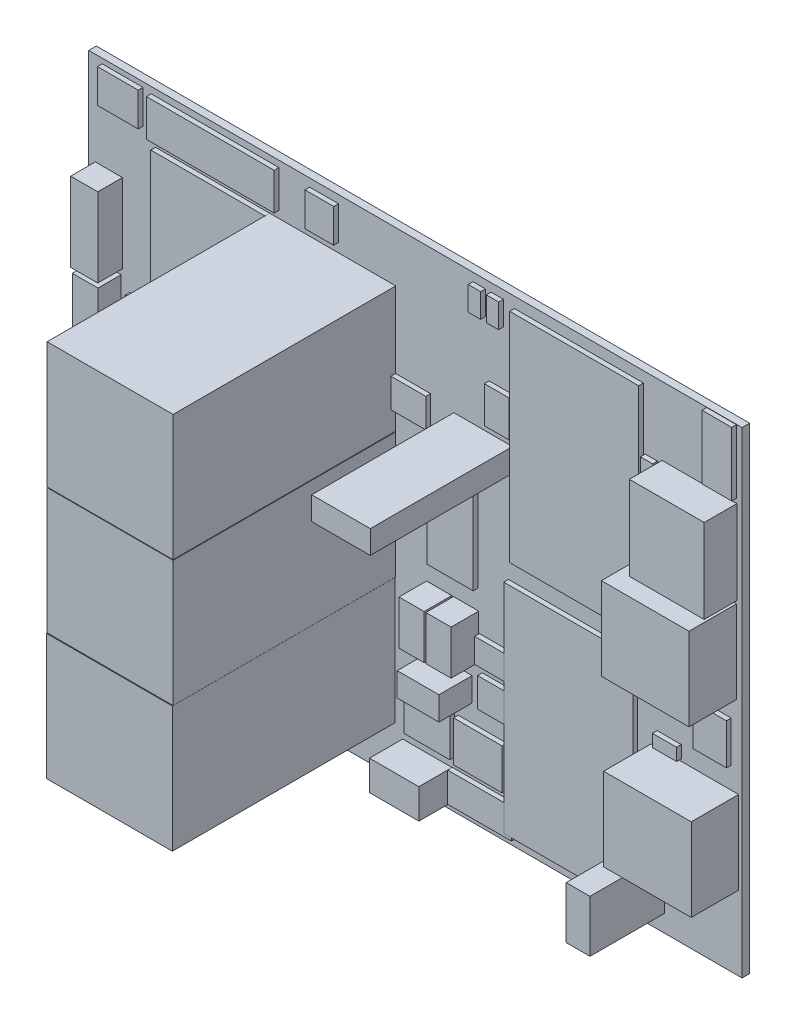
from build123d import *

# Parameters (mm, degrees)
ESQUISSE1_W                                    = 137.93375
ESQUISSE1_H                                    = 100.635
BOARD_DEPTH                                    = 1.6
ESQUISSE2_W                                    = 1.78
ESQUISSE2_H                                    = 3.14
CAP_0805_1_DEPTH                               = 1
ESQUISSE3_W                                    = 1.78
ESQUISSE3_H                                    = 3.14
CAP_0805_2_DEPTH                               = 1
ESQUISSE4_W                                    = 3.14
ESQUISSE4_H                                    = 1.78
CAP_0805_3_DEPTH                               = 1
ESQUISSE5_W                                    = 3.14
ESQUISSE5_H                                    = 1.78
CAP_0805_4_DEPTH                               = 1
ESQUISSE6_W                                    = 1.9914
ESQUISSE6_H                                    = 3.9968
EXTRUDE_C0805_1_DEPTH                          = 1
ESQUISSE7_W                                    = 1.9914
ESQUISSE7_H                                    = 3.9968
EXTRUDE_C0805_2_DEPTH                          = 1
ESQUISSE8_W                                    = 26.6
ESQUISSE8_H                                    = 26.55
SLPX102M200C4P3_47_000000_1_DEPTH              = 47
ESQUISSE9_W                                    = 26.6
ESQUISSE9_H                                    = 26.55
SLPX102M200C4P3_47_000000_2_DEPTH              = 47
ESQUISSE10_W                                   = 26.6
ESQUISSE10_H                                   = 26.55
SLPX102M200C4P3_47_000000_3_DEPTH              = 47
ESQUISSE11_W                                   = 5.425
ESQUISSE11_H                                   = 10.85
TO254P490X1000X2143_3P_4_900000_1_DEPTH        = 4.9
ESQUISSE12_W                                   = 5.425
ESQUISSE12_H                                   = 10.85
TO254P490X1000X2143_3P_4_900000_2_DEPTH        = 4.9
ESQUISSE13_W                                   = 6.35
ESQUISSE13_H                                   = 3.625
SOP50P490X110_10N_1_100000_1_DEPTH             = 1.1
ESQUISSE14_W                                   = 7.6835
ESQUISSE14_H                                   = 5.1435
AVRISP_1_DEPTH                                 = 1
ESQUISSE15_W                                   = 18.5
ESQUISSE15_H                                   = 17.49
UJ2BH1TH_10_000000_1_DEPTH                     = 10
ESQUISSE16_W                                   = 18.5
ESQUISSE16_H                                   = 17.49
UJ2BH1TH_10_000000_2_DEPTH                     = 10
ESQUISSE17_W                                   = 7.1
ESQUISSE17_H                                   = 8.62
EXTRUDE_691210910003_1_DEPTH                   = 1
ESQUISSE18_W                                   = 10.425
ESQUISSE18_H                                   = 6.3
SHDR3W64P0X250_1X3_990X575X700_7_000000_DEPTH  = 7
ESQUISSE19_W                                   = 13.46
ESQUISSE19_H                                   = 6.25
JST_B4B_XH_A_LF_SN_1_DEPTH                     = 1
ESQUISSE20_W                                   = 6.25
ESQUISSE20_H                                   = 13.46
JST_B4B_XH_A_LF_SN_2_DEPTH                     = 1
ESQUISSE21_W                                   = 6.08
ESQUISSE21_H                                   = 7.1
EXTRUDE_691210910002_1_DEPTH                   = 1
ESQUISSE22_W                                   = 8.62
ESQUISSE22_H                                   = 7.1
EXTRUDE_691210910003_2_DEPTH                   = 1
ESQUISSE23_W                                   = 25.5016
ESQUISSE23_H                                   = 5.2832
JTAG_20_1_DEPTH                                = 1
ESQUISSE24_W                                   = 6.08
ESQUISSE24_H                                   = 7.1
EXTRUDE_691210910002_2_DEPTH                   = 1
ESQUISSE25_W                                   = 8.62
ESQUISSE25_H                                   = 7.1
EXTRUDE_691210910003_3_DEPTH                   = 1
ESQUISSE26_W                                   = 15.8
ESQUISSE26_H                                   = 17.74
SS52100001_6_900000_1_DEPTH                    = 6.9
ESQUISSE27_W                                   = 5.08
ESQUISSE27_H                                   = 2.6162
EXTRUDE_1X02_1_DEPTH                           = 1
ESQUISSE28_W                                   = 5.08
ESQUISSE28_H                                   = 2.6162
EXTRUDE_1X02_2_DEPTH                           = 1
ESQUISSE29_W                                   = 2.6162
ESQUISSE29_H                                   = 5.08
EXTRUDE_1X02_3_DEPTH                           = 1
ESQUISSE30_W                                   = 5.1562
ESQUISSE30_H                                   = 7.6962
EXTRUDE_2X03_1_DEPTH                           = 1
ESQUISSE31_W                                   = 2.6162
ESQUISSE31_H                                   = 5.08
EXTRUDE_1X02_4_DEPTH                           = 1
ESQUISSE32_W                                   = 2.6162
ESQUISSE32_H                                   = 5.08
EXTRUDE_1X02_5_DEPTH                           = 1
ESQUISSE33_W                                   = 2.6162
ESQUISSE33_H                                   = 5.08
EXTRUDE_1X02_6_DEPTH                           = 1
ESQUISSE34_W                                   = 27.215
ESQUISSE34_H                                   = 45.954
IRM_10_1_DEPTH                                 = 1
ESQUISSE35_W                                   = 27.215
ESQUISSE35_H                                   = 45.954
IRM_10_2_DEPTH                                 = 1
ESQUISSE36_W                                   = 5.325
ESQUISSE36_H                                   = 9.35
DIP762W58P254L450H584Q4N_5_840000_1_DEPTH      = 5.84
ESQUISSE37_W                                   = 5.325
ESQUISSE37_H                                   = 9.35
DIP762W58P254L450H584Q4N_5_840000_2_DEPTH      = 5.84
ESQUISSE38_W                                   = 5.735
ESQUISSE38_H                                   = 16.68
TO545P521X1594X2566_3P_5_210000_1_DEPTH        = 5.21
ESQUISSE39_W                                   = 7.005
ESQUISSE39_H                                   = 4.28
ZTX458_4_010000_1_DEPTH                        = 4.01
ESQUISSE40_W                                   = 7.005
ESQUISSE40_H                                   = 4.28
ZTX458_4_010000_2_DEPTH                        = 4.01
ESQUISSE41_W                                   = 5.355
ESQUISSE41_H                                   = 11.21
TO254P483X1028X1700_3P_4_830000_1_DEPTH        = 4.83
ESQUISSE42_W                                   = 1.966
ESQUISSE42_H                                   = 3.946
EXTRUDE_R0805_1_DEPTH                          = 1
ESQUISSE43_W                                   = 1.966
ESQUISSE43_H                                   = 3.946
EXTRUDE_R0805_2_DEPTH                          = 1
ESQUISSE44_W                                   = 1.966
ESQUISSE44_H                                   = 3.946
EXTRUDE_R0805_3_DEPTH                          = 1
ESQUISSE45_W                                   = 3.946
ESQUISSE45_H                                   = 1.966
EXTRUDE_R0805_4_DEPTH                          = 1
ESQUISSE46_W                                   = 1.966
ESQUISSE46_H                                   = 3.946
EXTRUDE_R0805_5_DEPTH                          = 1
ESQUISSE47_W                                   = 1.966
ESQUISSE47_H                                   = 3.946
EXTRUDE_R0805_6_DEPTH                          = 1
ESQUISSE48_W                                   = 1.966
ESQUISSE48_H                                   = 3.946
EXTRUDE_R0805_7_DEPTH                          = 1
ESQUISSE49_W                                   = 1.966
ESQUISSE49_H                                   = 3.946
EXTRUDE_R0805_8_DEPTH                          = 1
ESQUISSE50_W                                   = 3.946
ESQUISSE50_H                                   = 1.966
EXTRUDE_R0805_9_DEPTH                          = 1
ESQUISSE51_W                                   = 1.966
ESQUISSE51_H                                   = 3.946
EXTRUDE_R0805_10_DEPTH                         = 1
ESQUISSE52_W                                   = 1.966
ESQUISSE52_H                                   = 3.946
EXTRUDE_R0805_11_DEPTH                         = 1
ESQUISSE53_W                                   = 1.966
ESQUISSE53_H                                   = 3.946
EXTRUDE_R0805_12_DEPTH                         = 1
ESQUISSE54_W                                   = 1.966
ESQUISSE54_H                                   = 3.946
EXTRUDE_R0805_13_DEPTH                         = 1
ESQUISSE55_W                                   = 3.946
ESQUISSE55_H                                   = 1.966
EXTRUDE_R0805_14_DEPTH                         = 1
ESQUISSE56_W                                   = 1.966
ESQUISSE56_H                                   = 3.946
EXTRUDE_R0805_15_DEPTH                         = 1
ESQUISSE57_W                                   = 3.946
ESQUISSE57_H                                   = 1.966
EXTRUDE_R0805_16_DEPTH                         = 1
ESQUISSE58_W                                   = 1.966
ESQUISSE58_H                                   = 3.946
EXTRUDE_R0805_17_DEPTH                         = 1
ESQUISSE59_W                                   = 3.946
ESQUISSE59_H                                   = 1.966
EXTRUDE_R0805_18_DEPTH                         = 1
ESQUISSE60_W                                   = 1.966
ESQUISSE60_H                                   = 3.946
EXTRUDE_R0805_19_DEPTH                         = 1
ESQUISSE61_W                                   = 3.946
ESQUISSE61_H                                   = 1.966
EXTRUDE_R0805_20_DEPTH                         = 1
ESQUISSE62_W                                   = 3.946
ESQUISSE62_H                                   = 1.966
EXTRUDE_R0805_21_DEPTH                         = 1
ESQUISSE63_W                                   = 3.946
ESQUISSE63_H                                   = 1.966
EXTRUDE_R0805_22_DEPTH                         = 1
ESQUISSE64_W                                   = 1.966
ESQUISSE64_H                                   = 3.946
EXTRUDE_R0805_23_DEPTH                         = 1
ESQUISSE65_W                                   = 3.946
ESQUISSE65_H                                   = 1.966
EXTRUDE_R0805_24_DEPTH                         = 1
ESQUISSE66_W                                   = 1.966
ESQUISSE66_H                                   = 3.946
EXTRUDE_R0805_25_DEPTH                         = 1
ESQUISSE67_W                                   = 1.966
ESQUISSE67_H                                   = 3.946
EXTRUDE_R0805_26_DEPTH                         = 1
ESQUISSE68_W                                   = 1.966
ESQUISSE68_H                                   = 3.946
EXTRUDE_R0805_27_DEPTH                         = 1
ESQUISSE69_W                                   = 1.966
ESQUISSE69_H                                   = 3.946
EXTRUDE_R0805_28_DEPTH                         = 1
ESQUISSE70_W                                   = 1.966
ESQUISSE70_H                                   = 3.946
EXTRUDE_R0805_29_DEPTH                         = 1
ESQUISSE71_W                                   = 1.966
ESQUISSE71_H                                   = 3.946
EXTRUDE_R0805_30_DEPTH                         = 1
ESQUISSE72_W                                   = 1.966
ESQUISSE72_H                                   = 3.946
EXTRUDE_R0805_31_DEPTH                         = 1
ESQUISSE73_W                                   = 1.966
ESQUISSE73_H                                   = 3.946
EXTRUDE_R0805_32_DEPTH                         = 1
ESQUISSE74_W                                   = 1.9914
ESQUISSE74_H                                   = 3.9968
EXTRUDE_M0805_1_DEPTH                          = 1
ESQUISSE75_W                                   = 1.9914
ESQUISSE75_H                                   = 3.9968
EXTRUDE_M0805_2_DEPTH                          = 1
ESQUISSE76_W                                   = 1.9914
ESQUISSE76_H                                   = 3.9968
EXTRUDE_M0805_3_DEPTH                          = 1
ESQUISSE77_W                                   = 1.9914
ESQUISSE77_H                                   = 3.9968
EXTRUDE_M0805_4_DEPTH                          = 1
ESQUISSE78_W                                   = 1.9914
ESQUISSE78_H                                   = 3.9968
EXTRUDE_M0805_5_DEPTH                          = 1
ESQUISSE79_W                                   = 1.9914
ESQUISSE79_H                                   = 3.9968
EXTRUDE_M0805_6_DEPTH                          = 1
ESQUISSE80_W                                   = 1.9914
ESQUISSE80_H                                   = 3.9968
EXTRUDE_M0805_7_DEPTH                          = 1
ESQUISSE81_W                                   = 1.9914
ESQUISSE81_H                                   = 3.9968
EXTRUDE_M0805_8_DEPTH                          = 1
ESQUISSE82_W                                   = 1.9914
ESQUISSE82_H                                   = 3.9968
EXTRUDE_M0805_9_DEPTH                          = 1
ESQUISSE83_W                                   = 1.9914
ESQUISSE83_H                                   = 3.9968
EXTRUDE_M0805_10_DEPTH                         = 1
ESQUISSE84_W                                   = 1.9914
ESQUISSE84_H                                   = 3.9968
EXTRUDE_M0805_11_DEPTH                         = 1
ESQUISSE85_W                                   = 1.9914
ESQUISSE85_H                                   = 3.9968
EXTRUDE_M0805_12_DEPTH                         = 1
ESQUISSE86_W                                   = 26.975
ESQUISSE86_H                                   = 7.8262
RS05_69_70_1_DEPTH                             = 1
ESQUISSE87_W                                   = 26.975
ESQUISSE87_H                                   = 7.8262
RS05_69_70_2_DEPTH                             = 1
ESQUISSE88_W                                   = 2.032
ESQUISSE88_H                                   = 7.874
EXTRUDE_0204_7_1_DEPTH                         = 1
ESQUISSE89_W                                   = 2.032
ESQUISSE89_H                                   = 7.874
EXTRUDE_0204_7_2_DEPTH                         = 1
ESQUISSE90_W                                   = 2.032
ESQUISSE90_H                                   = 7.874
EXTRUDE_0204_7_3_DEPTH                         = 1
ESQUISSE91_W                                   = 7.874
ESQUISSE91_H                                   = 2.032
EXTRUDE_0204_7_4_DEPTH                         = 1
ESQUISSE92_W                                   = 2.032
ESQUISSE92_H                                   = 7.874
EXTRUDE_0204_7_5_DEPTH                         = 1
ESQUISSE93_W                                   = 7.874
ESQUISSE93_H                                   = 2.032
EXTRUDE_0204_7_6_DEPTH                         = 1
ESQUISSE94_W                                   = 7.622509
ESQUISSE94_H                                   = 6.139509
EXTRUDE_1825910_6_1_DEPTH                      = 1
ESQUISSE95_W                                   = 7.622509
ESQUISSE95_H                                   = 6.139509
EXTRUDE_1825910_6_2_DEPTH                      = 1
ESQUISSE96_W                                   = 7.8592
ESQUISSE96_H                                   = 10.6354
SSOP28DB_1_DEPTH                               = 1
ESQUISSE97_W                                   = 5.02
ESQUISSE97_H                                   = 10.975
ON_SEMI_LM317BTG_0_15_750000_1_DEPTH           = 15.75
ESQUISSE98_W                                   = 9.6
ESQUISSE98_H                                   = 7.7
NATIONAL_SEMICONDUCTOR_LM1117IMPX_3_3_NO_DEPTH = 1
ESQUISSE99_W                                   = 9.6
ESQUISSE99_H                                   = 7.7
NATIONAL_SEMICONDUCTOR_LM1117IMPX_3_2_DEPTH    = 1
ESQUISSE100_W                                  = 11
ESQUISSE100_H                                  = 11
QFP80P900X900X120_32N_1_DEPTH                  = 1
ESQUISSE101_W                                  = 9.7
ESQUISSE101_H                                  = 10.71
TEXAS_INSTRUMENTS_TLC2262CP_0_1_DEPTH          = 1
ESQUISSE102_W                                  = 10.2362
ESQUISSE102_H                                  = 8.5852
DIP254P762X533_8_1_DEPTH                       = 1
ESQUISSE103_W                                  = 9.7
ESQUISSE103_H                                  = 20.2
TEXAS_INSTRUMENTS_TLC2264CN_0_1_DEPTH          = 1
ESQUISSE104_W                                  = 24.1
ESQUISSE104_H                                  = 34.2
SC_10_30J_1_DEPTH                              = 1
ESQUISSE105_W                                  = 24.1
ESQUISSE105_H                                  = 34.2
SC_10_30J_2_DEPTH                              = 1
ESQUISSE106_W                                  = 10.42
ESQUISSE106_H                                  = 11.46
QFP50P900X900X160_48N_1_DEPTH                  = 1
ESQUISSE107_W                                  = 12.376
ESQUISSE107_H                                  = 4.902
FOX_ELECTRONICS_FOXSLF_080_20_0_30_02000_DEPTH = 30.02
ESQUISSE108_W                                  = 8.826
ESQUISSE108_H                                  = 5
CSTLS16M0X53ZA0_7_000000_1_DEPTH               = 7


with BuildPart() as part:
    # Esquisse1 → BOARD (new body)
    with BuildSketch(Plane.XY):
        with Locations((66.903125, 50.15875)):
            Rectangle(ESQUISSE1_W, ESQUISSE1_H)
    extrude(amount=BOARD_DEPTH)


with BuildPart() as body_2:
    # Esquisse2 → CAP_0805-1 (new body)
    with BuildSketch(Plane.XY):
        with Locations((110.01375, 27.78125)):
            Rectangle(ESQUISSE2_W, ESQUISSE2_H)
    extrude(amount=-CAP_0805_1_DEPTH)


with BuildPart() as body_3:
    # Esquisse3 → CAP_0805-2 (new body)
    with BuildSketch(Plane.XY):
        with Locations((110.01375, 24.4475)):
            Rectangle(ESQUISSE3_W, ESQUISSE3_H)
    extrude(amount=-CAP_0805_2_DEPTH)


with BuildPart() as body_4:
    # Esquisse4 → CAP_0805-3 (new body)
    with BuildSketch(Plane.XY):
        with Locations((95.72625, 24.92375)):
            Rectangle(ESQUISSE4_W, ESQUISSE4_H)
    extrude(amount=-CAP_0805_3_DEPTH)


with BuildPart() as body_5:
    # Esquisse5 → CAP_0805-4 (new body)
    with BuildSketch(Plane.XY):
        with Locations((96.36125, 38.735)):
            Rectangle(ESQUISSE5_W, ESQUISSE5_H)
    extrude(amount=-CAP_0805_4_DEPTH)


with BuildPart() as body_6:
    # Esquisse6 → C0805-1 (new body)
    with BuildSketch(Plane.XY):
        with Locations((69.04355, 17.78)):
            Rectangle(ESQUISSE6_W, ESQUISSE6_H)
    extrude(amount=-EXTRUDE_C0805_1_DEPTH)


with BuildPart() as body_7:
    # Esquisse7 → C0805-2 (new body)
    with BuildSketch(Plane.XY):
        with Locations((69.04355, 12.3825)):
            Rectangle(ESQUISSE7_W, ESQUISSE7_H)
    extrude(amount=-EXTRUDE_C0805_2_DEPTH)


with BuildPart() as body_8:
    # Esquisse8 → SLPX102M200C4P3_47.000000-1 (new body)
    with BuildSketch(Plane.XY.offset(1.6)):
        with Locations((49.45, 49.8725)):
            Rectangle(ESQUISSE8_W, ESQUISSE8_H)
    extrude(amount=SLPX102M200C4P3_47_000000_1_DEPTH)


with BuildPart() as body_9:
    # Esquisse9 → SLPX102M200C4P3_47.000000-2 (new body)
    with BuildSketch(Plane.XY.offset(1.6)):
        with Locations((49.45, 76.5425)):
            Rectangle(ESQUISSE9_W, ESQUISSE9_H)
    extrude(amount=SLPX102M200C4P3_47_000000_2_DEPTH)


with BuildPart() as body_10:
    # Esquisse10 → SLPX102M200C4P3_47.000000-3 (new body)
    with BuildSketch(Plane.XY.offset(1.6)):
        with Locations((49.2925, 23.1525)):
            Rectangle(ESQUISSE10_W, ESQUISSE10_H)
    extrude(amount=SLPX102M200C4P3_47_000000_3_DEPTH)


with BuildPart() as body_11:
    # Esquisse11 → TO254P490X1000X2143-3P_4.900000-1 (new body)
    with BuildSketch(Plane.XY.offset(1.6)):
        with Locations((2.075, 57.4675)):
            Rectangle(ESQUISSE11_W, ESQUISSE11_H)
    extrude(amount=TO254P490X1000X2143_3P_4_900000_1_DEPTH)


with BuildPart() as body_12:
    # Esquisse12 → TO254P490X1000X2143-3P_4.900000-2 (new body)
    with BuildSketch(Plane.XY.offset(1.6)):
        with Locations((1.7575, 28.575)):
            Rectangle(ESQUISSE12_W, ESQUISSE12_H)
    extrude(amount=TO254P490X1000X2143_3P_4_900000_2_DEPTH)


with BuildPart() as body_13:
    # Esquisse13 → SOP50P490X110-10N_1.100000-1 (new body)
    with BuildSketch(Plane.XY):
        with Locations((82.70875, 13.64)):
            Rectangle(ESQUISSE13_W, ESQUISSE13_H)
    extrude(amount=-SOP50P490X110_10N_1_100000_1_DEPTH)


with BuildPart() as body_14:
    # Esquisse14 → AVRISP-1 (new body)
    with BuildSketch(Plane.XY.offset(1.6)):
        with Locations((84.2645, 32.512)):
            Rectangle(ESQUISSE14_W, ESQUISSE14_H)
    extrude(amount=AVRISP_1_DEPTH)


with BuildPart() as body_15:
    # Esquisse15 → UJ2BH1TH_10.000000-1 (new body)
    with BuildSketch(Plane.XY.offset(1.6)):
        with Locations((125.89375, 24.28875)):
            Rectangle(ESQUISSE15_W, ESQUISSE15_H)
    extrude(amount=UJ2BH1TH_10_000000_1_DEPTH)


with BuildPart() as body_16:
    # Esquisse16 → UJ2BH1TH_10.000000-2 (new body)
    with BuildSketch(Plane.XY.offset(1.6)):
        with Locations((125.4175, 58.89625)):
            Rectangle(ESQUISSE16_W, ESQUISSE16_H)
    extrude(amount=UJ2BH1TH_10_000000_2_DEPTH)


with BuildPart() as body_17:
    # Esquisse17 → 691210910003-1 (new body)
    with BuildSketch(Plane.XY.offset(1.6)):
        with Locations((130.01625, 41.91)):
            Rectangle(ESQUISSE17_W, ESQUISSE17_H)
    extrude(amount=EXTRUDE_691210910003_1_DEPTH)


with BuildPart() as body_18:
    # Esquisse18 → SHDR3W64P0X250_1X3_990X575X700_7.000000-1 (new body)
    with BuildSketch(Plane.XY.offset(1.6)):
        with Locations((69.42625, 4.555)):
            Rectangle(ESQUISSE18_W, ESQUISSE18_H)
    extrude(amount=SHDR3W64P0X250_1X3_990X575X700_7_000000_DEPTH)


with BuildPart() as body_19:
    # Esquisse19 → JST_B4B-XH-A_LF__SN_-1 (new body)
    with BuildSketch(Plane.XY.offset(1.6)):
        with Locations((81.46125, 4.6525)):
            Rectangle(ESQUISSE19_W, ESQUISSE19_H)
    extrude(amount=JST_B4B_XH_A_LF_SN_1_DEPTH)


with BuildPart() as body_20:
    # Esquisse20 → JST_B4B-XH-A_LF__SN_-2 (new body)
    with BuildSketch(Plane.XY.offset(1.6)):
        with Locations((131.555, 93.685)):
            Rectangle(ESQUISSE20_W, ESQUISSE20_H)
    extrude(amount=JST_B4B_XH_A_LF_SN_2_DEPTH)


with BuildPart() as body_21:
    # Esquisse21 → 691210910002-1 (new body)
    with BuildSketch(Plane.XY.offset(1.6)):
        with Locations((47.625, 95.25)):
            Rectangle(ESQUISSE21_W, ESQUISSE21_H)
    extrude(amount=EXTRUDE_691210910002_1_DEPTH)


with BuildPart() as body_22:
    # Esquisse22 → 691210910003-2 (new body)
    with BuildSketch(Plane.XY.offset(1.6)):
        with Locations((5.08, 95.885)):
            Rectangle(ESQUISSE22_W, ESQUISSE22_H)
    extrude(amount=EXTRUDE_691210910003_2_DEPTH)


with BuildPart() as body_23:
    # Esquisse23 → JTAG-20-1 (new body)
    with BuildSketch(Plane.XY):
        with Locations((65.3542, 96.2025)):
            Rectangle(ESQUISSE23_W, ESQUISSE23_H)
    extrude(amount=-JTAG_20_1_DEPTH)


with BuildPart() as body_24:
    # Esquisse24 → 691210910002-2 (new body)
    with BuildSketch(Plane.XY.offset(1.6)):
        with Locations((46.99, 4.7625)):
            Rectangle(ESQUISSE24_W, ESQUISSE24_H)
    extrude(amount=EXTRUDE_691210910002_2_DEPTH)


with BuildPart() as body_25:
    # Esquisse25 → 691210910003-3 (new body)
    with BuildSketch(Plane.XY.offset(1.6)):
        with Locations((5.715, 4.445)):
            Rectangle(ESQUISSE25_W, ESQUISSE25_H)
    extrude(amount=EXTRUDE_691210910003_3_DEPTH)


with BuildPart() as body_26:
    # Esquisse26 → SS52100001_6.900000-1 (new body)
    with BuildSketch(Plane.XY.offset(1.6)):
        with Locations((126.875, 77.16)):
            Rectangle(ESQUISSE26_W, ESQUISSE26_H)
    extrude(amount=SS52100001_6_900000_1_DEPTH)


with BuildPart() as body_27:
    # Esquisse27 → 1X02-1 (new body)
    with BuildSketch(Plane.XY.offset(1.6)):
        with Locations((120.49125, 34.80435)):
            Rectangle(ESQUISSE27_W, ESQUISSE27_H)
    extrude(amount=EXTRUDE_1X02_1_DEPTH)


with BuildPart() as body_28:
    # Esquisse28 → 1X02-2 (new body)
    with BuildSketch(Plane.XY.offset(1.6)):
        with Locations((121.44375, 48.13935)):
            Rectangle(ESQUISSE28_W, ESQUISSE28_H)
    extrude(amount=EXTRUDE_1X02_2_DEPTH)


with BuildPart() as body_29:
    # Esquisse29 → 1X02-3 (new body)
    with BuildSketch(Plane.XY.offset(1.6)):
        with Locations((116.8781, 71.27875)):
            Rectangle(ESQUISSE29_W, ESQUISSE29_H)
    extrude(amount=EXTRUDE_1X02_3_DEPTH)


with BuildPart() as body_30:
    # Esquisse30 → 2X03-1 (new body)
    with BuildSketch(Plane.XY.offset(1.6)):
        with Locations((85.0519, 78.4606)):
            Rectangle(ESQUISSE30_W, ESQUISSE30_H)
    extrude(amount=EXTRUDE_2X03_1_DEPTH)


with BuildPart() as body_31:
    # Esquisse31 → 1X02-4 (new body)
    with BuildSketch(Plane.XY.offset(1.6)):
        with Locations((84.1756, 96.2025)):
            Rectangle(ESQUISSE31_W, ESQUISSE31_H)
    extrude(amount=EXTRUDE_1X02_4_DEPTH)


with BuildPart() as body_32:
    # Esquisse32 → 1X02-5 (new body)
    with BuildSketch(Plane.XY.offset(1.6)):
        with Locations((80.3656, 96.2025)):
            Rectangle(ESQUISSE32_W, ESQUISSE32_H)
    extrude(amount=EXTRUDE_1X02_5_DEPTH)


with BuildPart() as body_33:
    # Esquisse33 → 1X02-6 (new body)
    with BuildSketch(Plane.XY.offset(1.6)):
        with Locations((116.71935, 82.8675)):
            Rectangle(ESQUISSE33_W, ESQUISSE33_H)
    extrude(amount=EXTRUDE_1X02_6_DEPTH)


with BuildPart() as body_34:
    # Esquisse34 → IRM-10-1 (new body)
    with BuildSketch(Plane.XY.offset(1.6)):
        with Locations((100.1845, 25.0925)):
            Rectangle(ESQUISSE34_W, ESQUISSE34_H)
    extrude(amount=IRM_10_1_DEPTH)


with BuildPart() as body_35:
    # Esquisse35 → IRM-10-2 (new body)
    with BuildSketch(Plane.XY.offset(1.6)):
        with Locations((101.428, 75.2375)):
            Rectangle(ESQUISSE35_W, ESQUISSE35_H)
    extrude(amount=IRM_10_2_DEPTH)


with BuildPart() as body_36:
    # Esquisse36 → DIP762W58P254L450H584Q4N_5.840000-1 (new body)
    with BuildSketch(Plane.XY.offset(1.6)):
        with Locations((77.61625, 34.44875)):
            Rectangle(ESQUISSE36_W, ESQUISSE36_H)
    extrude(amount=DIP762W58P254L450H584Q4N_5_840000_1_DEPTH)


with BuildPart() as body_37:
    # Esquisse37 → DIP762W58P254L450H584Q4N_5.840000-2 (new body)
    with BuildSketch(Plane.XY.offset(1.6)):
        with Locations((71.92625, 34.44875)):
            Rectangle(ESQUISSE37_W, ESQUISSE37_H)
    extrude(amount=DIP762W58P254L450H584Q4N_5_840000_2_DEPTH)


with BuildPart() as body_38:
    # Esquisse38 → TO545P521X1594X2566-3P_5.210000-1 (new body)
    with BuildSketch(Plane.XY.offset(1.6)):
        with Locations((2.1925, 72.4425)):
            Rectangle(ESQUISSE38_W, ESQUISSE38_H)
    extrude(amount=TO545P521X1594X2566_3P_5_210000_1_DEPTH)


with BuildPart() as body_39:
    # Esquisse39 → ZTX458_4.010000-1 (new body)
    with BuildSketch(Plane.XY.offset(1.6)):
        with Locations((17.88, 53.0225)):
            Rectangle(ESQUISSE39_W, ESQUISSE39_H)
    extrude(amount=ZTX458_4_010000_1_DEPTH)


with BuildPart() as body_40:
    # Esquisse40 → ZTX458_4.010000-2 (new body)
    with BuildSketch(Plane.XY.offset(1.6)):
        with Locations((17.88, 46.99)):
            Rectangle(ESQUISSE40_W, ESQUISSE40_H)
    extrude(amount=ZTX458_4_010000_2_DEPTH)


with BuildPart() as body_41:
    # Esquisse41 → TO254P483X1028X1700-3P_4.830000-1 (new body)
    with BuildSketch(Plane.XY.offset(1.6)):
        with Locations((1.8725, 15.875)):
            Rectangle(ESQUISSE41_W, ESQUISSE41_H)
    extrude(amount=TO254P483X1028X1700_3P_4_830000_1_DEPTH)


with BuildPart() as body_42:
    # Esquisse42 → R0805-1 (new body)
    with BuildSketch(Plane.XY):
        with Locations((110.01375, 16.51)):
            Rectangle(ESQUISSE42_W, ESQUISSE42_H)
    extrude(amount=-EXTRUDE_R0805_1_DEPTH)


with BuildPart() as body_43:
    # Esquisse43 → R0805-2 (new body)
    with BuildSketch(Plane.XY):
        with Locations((110.01375, 12.22375)):
            Rectangle(ESQUISSE43_W, ESQUISSE43_H)
    extrude(amount=-EXTRUDE_R0805_2_DEPTH)


with BuildPart() as body_44:
    # Esquisse44 → R0805-3 (new body)
    with BuildSketch(Plane.XY):
        with Locations((119.53875, 10.31875)):
            Rectangle(ESQUISSE44_W, ESQUISSE44_H)
    extrude(amount=-EXTRUDE_R0805_3_DEPTH)


with BuildPart() as body_45:
    # Esquisse45 → R0805-4 (new body)
    with BuildSketch(Plane.XY):
        with Locations((70.64375, 7.3025)):
            Rectangle(ESQUISSE45_W, ESQUISSE45_H)
    extrude(amount=-EXTRUDE_R0805_4_DEPTH)


with BuildPart() as body_46:
    # Esquisse46 → R0805-5 (new body)
    with BuildSketch(Plane.XY):
        with Locations((121.76125, 10.31875)):
            Rectangle(ESQUISSE46_W, ESQUISSE46_H)
    extrude(amount=-EXTRUDE_R0805_5_DEPTH)


with BuildPart() as body_47:
    # Esquisse47 → R0805-6 (new body)
    with BuildSketch(Plane.XY):
        with Locations((121.76125, 6.19125)):
            Rectangle(ESQUISSE47_W, ESQUISSE47_H)
    extrude(amount=-EXTRUDE_R0805_6_DEPTH)


with BuildPart() as body_48:
    # Esquisse48 → R0805-7 (new body)
    with BuildSketch(Plane.XY):
        with Locations((107.47375, 25.87625)):
            Rectangle(ESQUISSE48_W, ESQUISSE48_H)
    extrude(amount=-EXTRUDE_R0805_7_DEPTH)


with BuildPart() as body_49:
    # Esquisse49 → R0805-8 (new body)
    with BuildSketch(Plane.XY):
        with Locations((105.25125, 25.87625)):
            Rectangle(ESQUISSE49_W, ESQUISSE49_H)
    extrude(amount=-EXTRUDE_R0805_8_DEPTH)


with BuildPart() as body_50:
    # Esquisse50 → R0805-9 (new body)
    with BuildSketch(Plane.XY):
        with Locations((84.455, 22.86)):
            Rectangle(ESQUISSE50_W, ESQUISSE50_H)
    extrude(amount=-EXTRUDE_R0805_9_DEPTH)


with BuildPart() as body_51:
    # Esquisse51 → R0805-10 (new body)
    with BuildSketch(Plane.XY):
        with Locations((77.31125, 13.6525)):
            Rectangle(ESQUISSE51_W, ESQUISSE51_H)
    extrude(amount=-EXTRUDE_R0805_10_DEPTH)


with BuildPart() as body_52:
    # Esquisse52 → R0805-11 (new body)
    with BuildSketch(Plane.XY):
        with Locations((71.755, 17.78)):
            Rectangle(ESQUISSE52_W, ESQUISSE52_H)
    extrude(amount=-EXTRUDE_R0805_11_DEPTH)


with BuildPart() as body_53:
    # Esquisse53 → R0805-12 (new body)
    with BuildSketch(Plane.XY):
        with Locations((71.59625, 12.3825)):
            Rectangle(ESQUISSE53_W, ESQUISSE53_H)
    extrude(amount=-EXTRUDE_R0805_12_DEPTH)


with BuildPart() as body_54:
    # Esquisse54 → R0805-13 (new body)
    with BuildSketch(Plane.XY):
        with Locations((73.3425, 46.99)):
            Rectangle(ESQUISSE54_W, ESQUISSE54_H)
    extrude(amount=-EXTRUDE_R0805_13_DEPTH)


with BuildPart() as body_55:
    # Esquisse55 → R0805-14 (new body)
    with BuildSketch(Plane.XY):
        with Locations((77.31125, 28.41625)):
            Rectangle(ESQUISSE55_W, ESQUISSE55_H)
    extrude(amount=-EXTRUDE_R0805_14_DEPTH)


with BuildPart() as body_56:
    # Esquisse56 → R0805-15 (new body)
    with BuildSketch(Plane.XY):
        with Locations((69.215, 46.99)):
            Rectangle(ESQUISSE56_W, ESQUISSE56_H)
    extrude(amount=-EXTRUDE_R0805_15_DEPTH)


with BuildPart() as body_57:
    # Esquisse57 → R0805-16 (new body)
    with BuildSketch(Plane.XY):
        with Locations((119.22125, 55.245)):
            Rectangle(ESQUISSE57_W, ESQUISSE57_H)
    extrude(amount=-EXTRUDE_R0805_16_DEPTH)


with BuildPart() as body_58:
    # Esquisse58 → R0805-17 (new body)
    with BuildSketch(Plane.XY):
        with Locations((73.3425, 51.7525)):
            Rectangle(ESQUISSE58_W, ESQUISSE58_H)
    extrude(amount=-EXTRUDE_R0805_17_DEPTH)


with BuildPart() as body_59:
    # Esquisse59 → R0805-18 (new body)
    with BuildSketch(Plane.XY):
        with Locations((77.94625, 40.3225)):
            Rectangle(ESQUISSE59_W, ESQUISSE59_H)
    extrude(amount=-EXTRUDE_R0805_18_DEPTH)


with BuildPart() as body_60:
    # Esquisse60 → R0805-19 (new body)
    with BuildSketch(Plane.XY):
        with Locations((69.215, 51.7525)):
            Rectangle(ESQUISSE60_W, ESQUISSE60_H)
    extrude(amount=-EXTRUDE_R0805_19_DEPTH)


with BuildPart() as body_61:
    # Esquisse61 → R0805-20 (new body)
    with BuildSketch(Plane.XY):
        with Locations((119.22125, 59.69)):
            Rectangle(ESQUISSE61_W, ESQUISSE61_H)
    extrude(amount=-EXTRUDE_R0805_20_DEPTH)


with BuildPart() as body_62:
    # Esquisse62 → R0805-21 (new body)
    with BuildSketch(Plane.XY):
        with Locations((72.23125, 40.48125)):
            Rectangle(ESQUISSE62_W, ESQUISSE62_H)
    extrude(amount=-EXTRUDE_R0805_21_DEPTH)


with BuildPart() as body_63:
    # Esquisse63 → R0805-22 (new body)
    with BuildSketch(Plane.XY):
        with Locations((119.22125, 57.4675)):
            Rectangle(ESQUISSE63_W, ESQUISSE63_H)
    extrude(amount=-EXTRUDE_R0805_22_DEPTH)


with BuildPart() as body_64:
    # Esquisse64 → R0805-23 (new body)
    with BuildSketch(Plane.XY):
        with Locations((73.3425, 59.3725)):
            Rectangle(ESQUISSE64_W, ESQUISSE64_H)
    extrude(amount=-EXTRUDE_R0805_23_DEPTH)


with BuildPart() as body_65:
    # Esquisse65 → R0805-24 (new body)
    with BuildSketch(Plane.XY):
        with Locations((71.59625, 28.41625)):
            Rectangle(ESQUISSE65_W, ESQUISSE65_H)
    extrude(amount=-EXTRUDE_R0805_24_DEPTH)


with BuildPart() as body_66:
    # Esquisse66 → R0805-25 (new body)
    with BuildSketch(Plane.XY):
        with Locations((69.215, 59.3725)):
            Rectangle(ESQUISSE66_W, ESQUISSE66_H)
    extrude(amount=-EXTRUDE_R0805_25_DEPTH)


with BuildPart() as body_67:
    # Esquisse67 → R0805-26 (new body)
    with BuildSketch(Plane.XY):
        with Locations((77.1525, 59.3725)):
            Rectangle(ESQUISSE67_W, ESQUISSE67_H)
    extrude(amount=-EXTRUDE_R0805_26_DEPTH)


with BuildPart() as body_68:
    # Esquisse68 → R0805-27 (new body)
    with BuildSketch(Plane.XY):
        with Locations((81.28, 59.3725)):
            Rectangle(ESQUISSE68_W, ESQUISSE68_H)
    extrude(amount=-EXTRUDE_R0805_27_DEPTH)


with BuildPart() as body_69:
    # Esquisse69 → R0805-28 (new body)
    with BuildSketch(Plane.XY):
        with Locations((69.85, 65.56375)):
            Rectangle(ESQUISSE69_W, ESQUISSE69_H)
    extrude(amount=-EXTRUDE_R0805_28_DEPTH)


with BuildPart() as body_70:
    # Esquisse70 → R0805-29 (new body)
    with BuildSketch(Plane.XY):
        with Locations((77.1525, 46.99)):
            Rectangle(ESQUISSE70_W, ESQUISSE70_H)
    extrude(amount=-EXTRUDE_R0805_29_DEPTH)


with BuildPart() as body_71:
    # Esquisse71 → R0805-30 (new body)
    with BuildSketch(Plane.XY):
        with Locations((81.28, 46.99)):
            Rectangle(ESQUISSE71_W, ESQUISSE71_H)
    extrude(amount=-EXTRUDE_R0805_30_DEPTH)


with BuildPart() as body_72:
    # Esquisse72 → R0805-31 (new body)
    with BuildSketch(Plane.XY):
        with Locations((81.28, 51.7525)):
            Rectangle(ESQUISSE72_W, ESQUISSE72_H)
    extrude(amount=-EXTRUDE_R0805_31_DEPTH)


with BuildPart() as body_73:
    # Esquisse73 → R0805-32 (new body)
    with BuildSketch(Plane.XY):
        with Locations((77.1525, 51.7525)):
            Rectangle(ESQUISSE73_W, ESQUISSE73_H)
    extrude(amount=-EXTRUDE_R0805_32_DEPTH)


with BuildPart() as body_74:
    # Esquisse74 → M0805-1 (new body)
    with BuildSketch(Plane.XY):
        with Locations((67.6402, 89.2175)):
            Rectangle(ESQUISSE74_W, ESQUISSE74_H)
    extrude(amount=-EXTRUDE_M0805_1_DEPTH)


with BuildPart() as body_75:
    # Esquisse75 → M0805-2 (new body)
    with BuildSketch(Plane.XY):
        with Locations((69.8627, 89.2175)):
            Rectangle(ESQUISSE75_W, ESQUISSE75_H)
    extrude(amount=-EXTRUDE_M0805_2_DEPTH)


with BuildPart() as body_76:
    # Esquisse76 → M0805-3 (new body)
    with BuildSketch(Plane.XY):
        with Locations((72.0852, 89.2175)):
            Rectangle(ESQUISSE76_W, ESQUISSE76_H)
    extrude(amount=-EXTRUDE_M0805_3_DEPTH)


with BuildPart() as body_77:
    # Esquisse77 → M0805-4 (new body)
    with BuildSketch(Plane.XY):
        with Locations((81.5848, 89.2175)):
            Rectangle(ESQUISSE77_W, ESQUISSE77_H)
    extrude(amount=-EXTRUDE_M0805_4_DEPTH)


with BuildPart() as body_78:
    # Esquisse78 → M0805-5 (new body)
    with BuildSketch(Plane.XY):
        with Locations((83.8073, 89.2175)):
            Rectangle(ESQUISSE78_W, ESQUISSE78_H)
    extrude(amount=-EXTRUDE_M0805_5_DEPTH)


with BuildPart() as body_79:
    # Esquisse79 → M0805-6 (new body)
    with BuildSketch(Plane.XY):
        with Locations((79.3623, 89.2175)):
            Rectangle(ESQUISSE79_W, ESQUISSE79_H)
    extrude(amount=-EXTRUDE_M0805_6_DEPTH)


with BuildPart() as body_80:
    # Esquisse80 → M0805-7 (new body)
    with BuildSketch(Plane.XY):
        with Locations((74.44105, 89.2175)):
            Rectangle(ESQUISSE80_W, ESQUISSE80_H)
    extrude(amount=-EXTRUDE_M0805_7_DEPTH)


with BuildPart() as body_81:
    # Esquisse81 → M0805-8 (new body)
    with BuildSketch(Plane.XY):
        with Locations((76.8477, 89.2175)):
            Rectangle(ESQUISSE81_W, ESQUISSE81_H)
    extrude(amount=-EXTRUDE_M0805_8_DEPTH)


with BuildPart() as body_82:
    # Esquisse82 → M0805-9 (new body)
    with BuildSketch(Plane.XY):
        with Locations((76.1873, 65.56375)):
            Rectangle(ESQUISSE82_W, ESQUISSE82_H)
    extrude(amount=-EXTRUDE_M0805_9_DEPTH)


with BuildPart() as body_83:
    # Esquisse83 → M0805-10 (new body)
    with BuildSketch(Plane.XY):
        with Locations((78.25105, 65.56375)):
            Rectangle(ESQUISSE83_W, ESQUISSE83_H)
    extrude(amount=-EXTRUDE_M0805_10_DEPTH)


with BuildPart() as body_84:
    # Esquisse84 → M0805-11 (new body)
    with BuildSketch(Plane.XY):
        with Locations((72.0598, 65.56375)):
            Rectangle(ESQUISSE84_W, ESQUISSE84_H)
    extrude(amount=-EXTRUDE_M0805_11_DEPTH)


with BuildPart() as body_85:
    # Esquisse85 → M0805-12 (new body)
    with BuildSketch(Plane.XY):
        with Locations((74.12355, 65.56375)):
            Rectangle(ESQUISSE85_W, ESQUISSE85_H)
    extrude(amount=-EXTRUDE_M0805_12_DEPTH)


with BuildPart() as body_86:
    # Esquisse86 → RS05_69-70-1 (new body)
    with BuildSketch(Plane.XY.offset(1.6)):
        with Locations((24.6, 95.2119)):
            Rectangle(ESQUISSE86_W, ESQUISSE86_H)
    extrude(amount=RS05_69_70_1_DEPTH)


with BuildPart() as body_87:
    # Esquisse87 → RS05_69-70-2 (new body)
    with BuildSketch(Plane.XY.offset(1.6)):
        with Locations((25.235, 4.7244)):
            Rectangle(ESQUISSE87_W, ESQUISSE87_H)
    extrude(amount=RS05_69_70_2_DEPTH)


with BuildPart() as body_88:
    # Esquisse88 → 0204_7-1 (new body)
    with BuildSketch(Plane.XY):
        with Locations((7.62, 72.1995)):
            Rectangle(ESQUISSE88_W, ESQUISSE88_H)
    extrude(amount=-EXTRUDE_0204_7_1_DEPTH)


with BuildPart() as body_89:
    # Esquisse89 → 0204_7-2 (new body)
    with BuildSketch(Plane.XY.offset(1.6)):
        with Locations((7.62, 56.642)):
            Rectangle(ESQUISSE89_W, ESQUISSE89_H)
    extrude(amount=EXTRUDE_0204_7_2_DEPTH)


with BuildPart() as body_90:
    # Esquisse90 → 0204_7-3 (new body)
    with BuildSketch(Plane.XY.offset(1.6)):
        with Locations((7.62, 15.4305)):
            Rectangle(ESQUISSE90_W, ESQUISSE90_H)
    extrude(amount=EXTRUDE_0204_7_3_DEPTH)


with BuildPart() as body_91:
    # Esquisse91 → 0204_7-4 (new body)
    with BuildSketch(Plane.XY.offset(1.6)):
        with Locations((29.337, 49.8475)):
            Rectangle(ESQUISSE91_W, ESQUISSE91_H)
    extrude(amount=EXTRUDE_0204_7_4_DEPTH)


with BuildPart() as body_92:
    # Esquisse92 → 0204_7-5 (new body)
    with BuildSketch(Plane.XY.offset(1.6)):
        with Locations((7.62, 36.703)):
            Rectangle(ESQUISSE92_W, ESQUISSE92_H)
    extrude(amount=EXTRUDE_0204_7_5_DEPTH)


with BuildPart() as body_93:
    # Esquisse93 → 0204_7-6 (new body)
    with BuildSketch(Plane.XY.offset(1.6)):
        with Locations((29.337, 52.3875)):
            Rectangle(ESQUISSE93_W, ESQUISSE93_H)
    extrude(amount=EXTRUDE_0204_7_6_DEPTH)


with BuildPart() as body_94:
    # Esquisse94 → 1825910-6-1 (new body)
    with BuildSketch(Plane.XY.offset(1.6)):
        with Locations((84.8487545, 25.1522545)):
            Rectangle(ESQUISSE94_W, ESQUISSE94_H)
    extrude(amount=EXTRUDE_1825910_6_1_DEPTH)


with BuildPart() as body_95:
    # Esquisse95 → 1825910-6-2 (new body)
    with BuildSketch(Plane.XY.offset(1.6)):
        with Locations((66.2812455, 70.7327455)):
            Rectangle(ESQUISSE95_W, ESQUISSE95_H)
    extrude(amount=EXTRUDE_1825910_6_2_DEPTH)


with BuildPart() as body_96:
    # Esquisse96 → SSOP28DB-1 (new body)
    with BuildSketch(Plane.XY):
        with Locations((115.38165, 24.88225)):
            Rectangle(ESQUISSE96_W, ESQUISSE96_H)
    extrude(amount=-SSOP28DB_1_DEPTH)


with BuildPart() as body_97:
    # Esquisse97 → ON_SEMI_LM317BTG_0_15.750000-1 (new body)
    with BuildSketch(Plane.XY.offset(1.6)):
        with Locations((116.99875, 8.97875)):
            Rectangle(ESQUISSE97_W, ESQUISSE97_H)
    extrude(amount=ON_SEMI_LM317BTG_0_15_750000_1_DEPTH)


with BuildPart() as body_98:
    # Esquisse98 → NATIONAL_SEMICONDUCTOR_LM1117IMPX-3_3-NO (new body)
    with BuildSketch(Plane.XY):
        with Locations((93.82125, 19.20875)):
            Rectangle(ESQUISSE98_W, ESQUISSE98_H)
    extrude(amount=-NATIONAL_SEMICONDUCTOR_LM1117IMPX_3_3_NO_DEPTH)


with BuildPart() as body_99:
    # Esquisse99 → NATIONAL_SEMICONDUCTOR_LM1117IMPX-3_ 2 (new body)
    with BuildSketch(Plane.XY):
        with Locations((96.04375, 69.69125)):
            Rectangle(ESQUISSE99_W, ESQUISSE99_H)
    extrude(amount=-NATIONAL_SEMICONDUCTOR_LM1117IMPX_3_2_DEPTH)


with BuildPart() as body_100:
    # Esquisse100 → QFP80P900X900X120-32N-1 (new body)
    with BuildSketch(Plane.XY):
        with Locations((96.36125, 32.22625)):
            Rectangle(ESQUISSE100_W, ESQUISSE100_H)
    extrude(amount=-QFP80P900X900X120_32N_1_DEPTH)


with BuildPart() as body_101:
    # Esquisse101 → TEXAS_INSTRUMENTS_TLC2262CP_0-1 (new body)
    with BuildSketch(Plane.XY.offset(1.6)):
        with Locations((70.32625, 15.245)):
            Rectangle(ESQUISSE101_W, ESQUISSE101_H)
    extrude(amount=TEXAS_INSTRUMENTS_TLC2262CP_0_1_DEPTH)


with BuildPart() as body_102:
    # Esquisse102 → DIP254P762X533-8-1 (new body)
    with BuildSketch(Plane.XY.offset(1.6)):
        with Locations((81.08315, 13.6525)):
            Rectangle(ESQUISSE102_W, ESQUISSE102_H)
    extrude(amount=DIP254P762X533_8_1_DEPTH)


with BuildPart() as body_103:
    # Esquisse103 → TEXAS_INSTRUMENTS_TLC2264CN_0-1 (new body)
    with BuildSketch(Plane.XY.offset(1.6)):
        with Locations((75.2475, 53.34)):
            Rectangle(ESQUISSE103_W, ESQUISSE103_H)
    extrude(amount=TEXAS_INSTRUMENTS_TLC2264CN_0_1_DEPTH)


with BuildPart() as body_104:
    # Esquisse104 → SC-10-30J-1 (new body)
    with BuildSketch(Plane.XY.offset(1.6)):
        with Locations((24.08, 72.7075)):
            Rectangle(ESQUISSE104_W, ESQUISSE104_H)
    extrude(amount=SC_10_30J_1_DEPTH)


with BuildPart() as body_105:
    # Esquisse105 → SC-10-30J-2 (new body)
    with BuildSketch(Plane.XY.offset(1.6)):
        with Locations((23.2275, 26.9875)):
            Rectangle(ESQUISSE105_W, ESQUISSE105_H)
    extrude(amount=SC_10_30J_2_DEPTH)


with BuildPart() as body_106:
    # Esquisse106 → QFP50P900X900X160-48N-1 (new body)
    with BuildSketch(Plane.XY):
        with Locations((74.77125, 77.9025)):
            Rectangle(ESQUISSE106_W, ESQUISSE106_H)
    extrude(amount=-QFP50P900X900X160_48N_1_DEPTH)


with BuildPart() as body_107:
    # Esquisse107 → FOX_ELECTRONICS_FOXSLF-080-20_0_30.020000-1 (new body)
    with BuildSketch(Plane.XY.offset(1.6)):
        with Locations((81.2105, 70.32625)):
            Rectangle(ESQUISSE107_W, ESQUISSE107_H)
    extrude(amount=FOX_ELECTRONICS_FOXSLF_080_20_0_30_02000_DEPTH)


with BuildPart() as body_108:
    # Esquisse108 → CSTLS16M0X53ZA0_7.000000-1 (new body)
    with BuildSketch(Plane.XY.offset(1.6)):
        with Locations((74.46325, 24.13)):
            Rectangle(ESQUISSE108_W, ESQUISSE108_H)
    extrude(amount=CSTLS16M0X53ZA0_7_000000_1_DEPTH)


solid = Compound([part.part, body_2.part, body_3.part, body_4.part, body_5.part, body_6.part, body_7.part, body_8.part, body_9.part, body_10.part, body_11.part, body_12.part, body_13.part, body_14.part, body_15.part, body_16.part, body_17.part, body_18.part, body_19.part, body_20.part, body_21.part, body_22.part, body_23.part, body_24.part, body_25.part, body_26.part, body_27.part, body_28.part, body_29.part, body_30.part, body_31.part, body_32.part, body_33.part, body_34.part, body_35.part, body_36.part, body_37.part, body_38.part, body_39.part, body_40.part, body_41.part, body_42.part, body_43.part, body_44.part, body_45.part, body_46.part, body_47.part, body_48.part, body_49.part, body_50.part, body_51.part, body_52.part, body_53.part, body_54.part, body_55.part, body_56.part, body_57.part, body_58.part, body_59.part, body_60.part, body_61.part, body_62.part, body_63.part, body_64.part, body_65.part, body_66.part, body_67.part, body_68.part, body_69.part, body_70.part, body_71.part, body_72.part, body_73.part, body_74.part, body_75.part, body_76.part, body_77.part, body_78.part, body_79.part, body_80.part, body_81.part, body_82.part, body_83.part, body_84.part, body_85.part, body_86.part, body_87.part, body_88.part, body_89.part, body_90.part, body_91.part, body_92.part, body_93.part, body_94.part, body_95.part, body_96.part, body_97.part, body_98.part, body_99.part, body_100.part, body_101.part, body_102.part, body_103.part, body_104.part, body_105.part, body_106.part, body_107.part, body_108.part])
